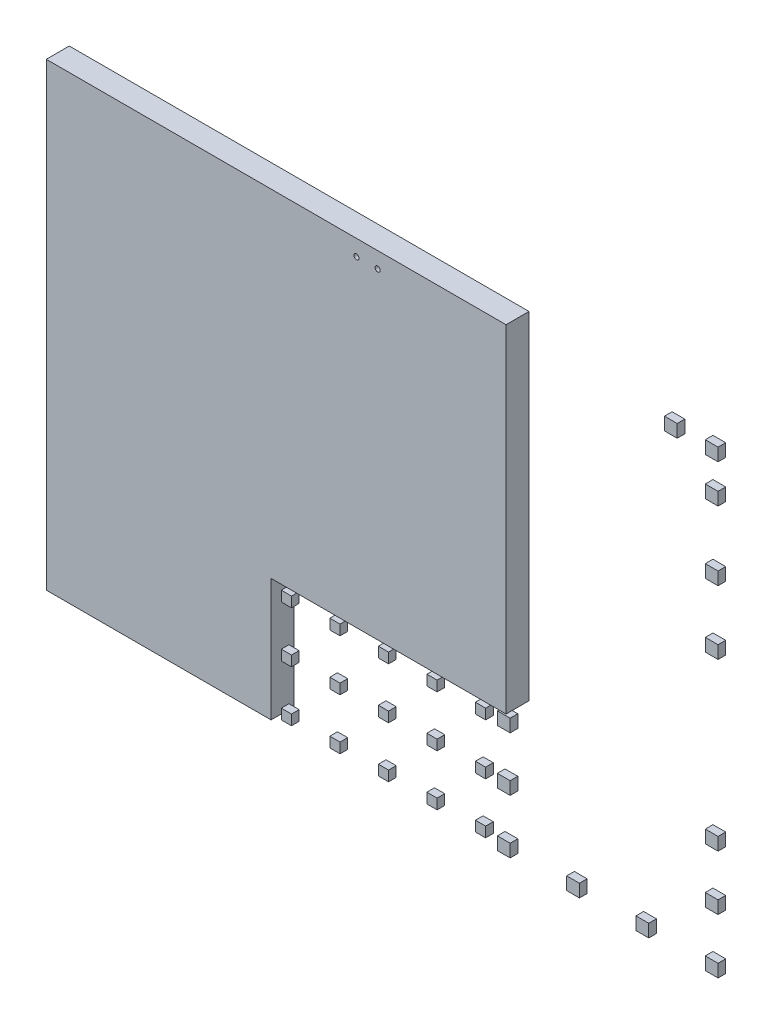
from build123d import *

# Parameters (mm, degrees)
SKETCH_1_R         = 50
EXTRUDE_1_DEPTH    = 150
SKETCH_1_W         = 250
SKETCH_1_H         = 250
EXTRUDE_1_2_DEPTH  = 150
EXTRUDE_1_3_DEPTH  = 150
EXTRUDE_1_4_DEPTH  = 150
EXTRUDE_1_5_DEPTH  = 150
EXTRUDE_1_6_DEPTH  = 150
EXTRUDE_1_7_DEPTH  = 150
EXTRUDE_1_8_DEPTH  = 150
EXTRUDE_1_9_DEPTH  = 150
EXTRUDE_1_10_DEPTH = 150
EXTRUDE_1_11_DEPTH = 150
EXTRUDE_1_12_DEPTH = 150
EXTRUDE_1_13_DEPTH = 150
EXTRUDE_1_14_DEPTH = 150
SKETCH_1_W_2       = 200
SKETCH_1_H_2       = 200
EXTRUDE_1_15_DEPTH = 150
EXTRUDE_1_16_DEPTH = 150
EXTRUDE_1_17_DEPTH = 150
EXTRUDE_1_18_DEPTH = 150
EXTRUDE_1_19_DEPTH = 150
EXTRUDE_1_20_DEPTH = 150
EXTRUDE_1_21_DEPTH = 150
EXTRUDE_1_22_DEPTH = 150
EXTRUDE_1_23_DEPTH = 150
EXTRUDE_1_24_DEPTH = 150
EXTRUDE_1_25_DEPTH = 150
EXTRUDE_1_26_DEPTH = 150
EXTRUDE_1_27_DEPTH = 150
EXTRUDE_1_28_DEPTH = 150
EXTRUDE_1_29_DEPTH = 150
EXTRUDE_2_DEPTH    = 300


with BuildPart() as part:
    # Эскиз1 → Бобышка-Вытянуть1 (new body)
    with BuildSketch(Plane.XY):
        Polygon((0, 0), (9000, 0), (9000, -6600), (4400, -6600), (4400, -9000), (0, -9000), align=None)
        with Locations((6486.244831881, -312.492160742)):
            Circle(SKETCH_1_R, mode=Mode.SUBTRACT)
        with Locations((6070.943926101, -312.492160742)):
            Circle(SKETCH_1_R, mode=Mode.SUBTRACT)
    extrude(amount=-EXTRUDE_1_DEPTH)

    # Эскиз2 → Бобышка-Вытянуть2 (add)
    with BuildSketch(Plane(origin=(0, 0, -150), x_dir=(-1, 0, 0), z_dir=(0, 0, -1))):
        Polygon((0, -9000), (0, 0), (-9000, 0), (-9000, -6600), (-4400, -6600), (-4400, -9000), align=None)
        Polygon((-450, -8550), (-450, -450), (-8550, -450), (-8550, -6150), (-3950, -6150), (-3950, -8550), align=None, mode=Mode.SUBTRACT)
    extrude(amount=EXTRUDE_2_DEPTH)


with BuildPart() as body_2:
    # Эскиз1 → Extrude 1 2 (new body)
    with BuildSketch(Plane.XY):
        with Locations((8955, -8875)):
            Rectangle(SKETCH_1_W, SKETCH_1_H)
    extrude(amount=-EXTRUDE_1_2_DEPTH)


with BuildPart() as body_3:
    # Эскиз1 → Extrude 1 3 (new body)
    with BuildSketch(Plane.XY):
        with Locations((8955, -6755)):
            Rectangle(SKETCH_1_W, SKETCH_1_H)
    extrude(amount=-EXTRUDE_1_3_DEPTH)


with BuildPart() as body_4:
    # Эскиз1 → Extrude 1 4 (new body)
    with BuildSketch(Plane.XY):
        with Locations((8955, -7815)):
            Rectangle(SKETCH_1_W, SKETCH_1_H)
    extrude(amount=-EXTRUDE_1_4_DEPTH)


with BuildPart() as body_5:
    # Эскиз1 → Extrude 1 5 (new body)
    with BuildSketch(Plane.XY):
        with Locations((10311.666666667, -8875)):
            Rectangle(SKETCH_1_W, SKETCH_1_H)
    extrude(amount=-EXTRUDE_1_5_DEPTH)


with BuildPart() as body_6:
    # Эскиз1 → Extrude 1 6 (new body)
    with BuildSketch(Plane.XY):
        with Locations((11668.333333333, -8875)):
            Rectangle(SKETCH_1_W, SKETCH_1_H)
    extrude(amount=-EXTRUDE_1_6_DEPTH)


with BuildPart() as body_7:
    # Эскиз1 → Extrude 1 7 (new body)
    with BuildSketch(Plane.XY):
        with Locations((13025, -8875)):
            Rectangle(SKETCH_1_W, SKETCH_1_H)
    extrude(amount=-EXTRUDE_1_7_DEPTH)


with BuildPart() as body_8:
    # Эскиз1 → Extrude 1 8 (new body)
    with BuildSketch(Plane.XY):
        with Locations((13025, -6725)):
            Rectangle(SKETCH_1_W, SKETCH_1_H)
    extrude(amount=-EXTRUDE_1_8_DEPTH)


with BuildPart() as body_9:
    # Эскиз1 → Extrude 1 9 (new body)
    with BuildSketch(Plane.XY):
        with Locations((13025, -7800)):
            Rectangle(SKETCH_1_W, SKETCH_1_H)
    extrude(amount=-EXTRUDE_1_9_DEPTH)


with BuildPart() as body_10:
    # Эскиз1 → Extrude 1 10 (new body)
    with BuildSketch(Plane.XY):
        with Locations((13025, -3475)):
            Rectangle(SKETCH_1_W, SKETCH_1_H)
    extrude(amount=-EXTRUDE_1_10_DEPTH)


with BuildPart() as body_11:
    # Эскиз1 → Extrude 1 11 (new body)
    with BuildSketch(Plane.XY):
        with Locations((13025, -2225)):
            Rectangle(SKETCH_1_W, SKETCH_1_H)
    extrude(amount=-EXTRUDE_1_11_DEPTH)


with BuildPart() as body_12:
    # Эскиз1 → Extrude 1 12 (new body)
    with BuildSketch(Plane.XY):
        with Locations((13025, -875)):
            Rectangle(SKETCH_1_W, SKETCH_1_H)
    extrude(amount=-EXTRUDE_1_12_DEPTH)


with BuildPart() as body_13:
    # Эскиз1 → Extrude 1 13 (new body)
    with BuildSketch(Plane.XY):
        with Locations((13025, -125)):
            Rectangle(SKETCH_1_W, SKETCH_1_H)
    extrude(amount=-EXTRUDE_1_13_DEPTH)


with BuildPart() as body_14:
    # Эскиз1 → Extrude 1 14 (new body)
    with BuildSketch(Plane.XY):
        with Locations((12225, -125)):
            Rectangle(SKETCH_1_W, SKETCH_1_H)
    extrude(amount=-EXTRUDE_1_14_DEPTH)


with BuildPart() as body_15:
    # Эскиз1 → Extrude 1 15 (new body)
    with BuildSketch(Plane.XY):
        with Locations((4700, -6800)):
            Rectangle(SKETCH_1_W_2, SKETCH_1_H_2)
    extrude(amount=-EXTRUDE_1_15_DEPTH)


with BuildPart() as body_16:
    # Эскиз1 → Extrude 1 16 (new body)
    with BuildSketch(Plane.XY):
        with Locations((4700, -7800)):
            Rectangle(SKETCH_1_W_2, SKETCH_1_H_2)
    extrude(amount=-EXTRUDE_1_16_DEPTH)


with BuildPart() as body_17:
    # Эскиз1 → Extrude 1 17 (new body)
    with BuildSketch(Plane.XY):
        with Locations((4700, -8800)):
            Rectangle(SKETCH_1_W_2, SKETCH_1_H_2)
    extrude(amount=-EXTRUDE_1_17_DEPTH)


with BuildPart() as body_18:
    # Эскиз1 → Extrude 1 18 (new body)
    with BuildSketch(Plane.XY):
        with Locations((5650, -6800)):
            Rectangle(SKETCH_1_W_2, SKETCH_1_H_2)
    extrude(amount=-EXTRUDE_1_18_DEPTH)


with BuildPart() as body_19:
    # Эскиз1 → Extrude 1 19 (new body)
    with BuildSketch(Plane.XY):
        with Locations((5650, -7800)):
            Rectangle(SKETCH_1_W_2, SKETCH_1_H_2)
    extrude(amount=-EXTRUDE_1_19_DEPTH)


with BuildPart() as body_20:
    # Эскиз1 → Extrude 1 20 (new body)
    with BuildSketch(Plane.XY):
        with Locations((5650, -8800)):
            Rectangle(SKETCH_1_W_2, SKETCH_1_H_2)
    extrude(amount=-EXTRUDE_1_20_DEPTH)


with BuildPart() as body_21:
    # Эскиз1 → Extrude 1 21 (new body)
    with BuildSketch(Plane.XY):
        with Locations((6600, -6800)):
            Rectangle(SKETCH_1_W_2, SKETCH_1_H_2)
    extrude(amount=-EXTRUDE_1_21_DEPTH)


with BuildPart() as body_22:
    # Эскиз1 → Extrude 1 22 (new body)
    with BuildSketch(Plane.XY):
        with Locations((6600, -7800)):
            Rectangle(SKETCH_1_W_2, SKETCH_1_H_2)
    extrude(amount=-EXTRUDE_1_22_DEPTH)


with BuildPart() as body_23:
    # Эскиз1 → Extrude 1 23 (new body)
    with BuildSketch(Plane.XY):
        with Locations((6600, -8800)):
            Rectangle(SKETCH_1_W_2, SKETCH_1_H_2)
    extrude(amount=-EXTRUDE_1_23_DEPTH)


with BuildPart() as body_24:
    # Эскиз1 → Extrude 1 24 (new body)
    with BuildSketch(Plane.XY):
        with Locations((7550, -6800)):
            Rectangle(SKETCH_1_W_2, SKETCH_1_H_2)
    extrude(amount=-EXTRUDE_1_24_DEPTH)


with BuildPart() as body_25:
    # Эскиз1 → Extrude 1 25 (new body)
    with BuildSketch(Plane.XY):
        with Locations((7550, -7800)):
            Rectangle(SKETCH_1_W_2, SKETCH_1_H_2)
    extrude(amount=-EXTRUDE_1_25_DEPTH)


with BuildPart() as body_26:
    # Эскиз1 → Extrude 1 26 (new body)
    with BuildSketch(Plane.XY):
        with Locations((7550, -8800)):
            Rectangle(SKETCH_1_W_2, SKETCH_1_H_2)
    extrude(amount=-EXTRUDE_1_26_DEPTH)


with BuildPart() as body_27:
    # Эскиз1 → Extrude 1 27 (new body)
    with BuildSketch(Plane.XY):
        with Locations((8500, -6800)):
            Rectangle(SKETCH_1_W_2, SKETCH_1_H_2)
    extrude(amount=-EXTRUDE_1_27_DEPTH)


with BuildPart() as body_28:
    # Эскиз1 → Extrude 1 28 (new body)
    with BuildSketch(Plane.XY):
        with Locations((8500, -7800)):
            Rectangle(SKETCH_1_W_2, SKETCH_1_H_2)
    extrude(amount=-EXTRUDE_1_28_DEPTH)


with BuildPart() as body_29:
    # Эскиз1 → Extrude 1 29 (new body)
    with BuildSketch(Plane.XY):
        with Locations((8500, -8800)):
            Rectangle(SKETCH_1_W_2, SKETCH_1_H_2)
    extrude(amount=-EXTRUDE_1_29_DEPTH)


solid = Compound([part.part, body_2.part, body_3.part, body_4.part, body_5.part, body_6.part, body_7.part, body_8.part, body_9.part, body_10.part, body_11.part, body_12.part, body_13.part, body_14.part, body_15.part, body_16.part, body_17.part, body_18.part, body_19.part, body_20.part, body_21.part, body_22.part, body_23.part, body_24.part, body_25.part, body_26.part, body_27.part, body_28.part, body_29.part])
